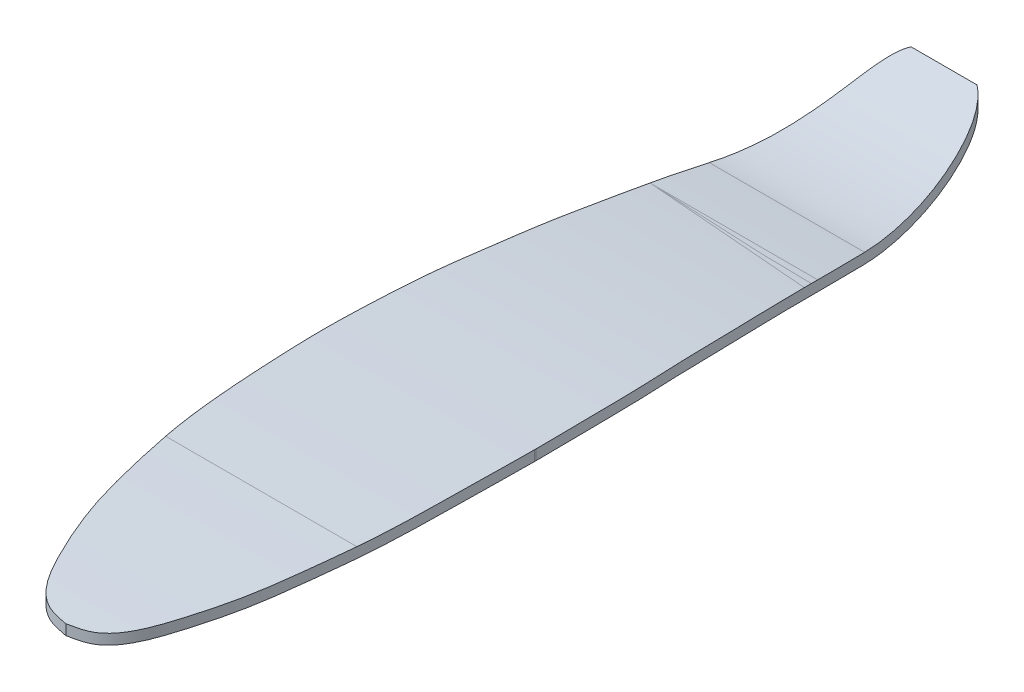
from build123d import *

# Parameters (mm, degrees)
BOSS_EXTRUDE1_DEPTH     = 102
CUT_EXTRUDE1_DEPTH      = 100
CUT_EXTRUDE1_DEPTH_BACK = 100
SKETCH9_OUTSIDE_W       = 383.336
SKETCH9_OUTSIDE_H       = 1040.511


with BuildPart() as part:
    # Sketch4 → Boss-Extrude1 (new, symmetric)
    with BuildSketch(Plane(origin=(0, 0, 0), x_dir=(0, 0, -1), z_dir=(1, 0, 0))):
        with BuildLine():
            Line((0, 0), (-1.175236097, 9.930700888))
            ThreePointArc((-1.175236097, 9.930700888), (350, 30.638141935), (701.175236097, 9.930700888))
            ThreePointArc((701.175236097, 9.930700888), (781.759467973, 16.244113872), (853.820514615, 52.862185471))
            Line((853.820514615, 52.862185471), (860, 45))
            ThreePointArc((860, 45), (784.466923743, 6.617604471), (700, 0))
            ThreePointArc((700, 0), (350, 20.638141935), (0, 0))
        make_face()
    extrude(amount=BOSS_EXTRUDE1_DEPTH, both=True)

    # Sketch9 outside → Cut-Extrude1 (cut, two sides: drawn at the far end of the back side and taken through both)
    with BuildSketch(Plane(origin=(0, 0, 0), x_dir=(1, 0, 0), z_dir=(0, 1, 0)).offset(-CUT_EXTRUDE1_DEPTH_BACK)):
        with Locations((0, 429.4125)):
            Rectangle(SKETCH9_OUTSIDE_W, SKETCH9_OUTSIDE_H)
        with BuildLine():
            add(Edge.make_bspline(
                [(0, 0), (6.949684174, 1.176515835), (35.07025548, 5.937062732), (58.348166284, 53.142776701), (77.037488771, 103.637606497), (87.180450732, 154.892232469), (95.846331303, 204.703932058), (99.26688254, 254.96702494), (101.060473074, 304.980056328), (102.487544, 355.002947506), (100.988766282, 405.008150114), (99.554196599, 455.074321396), (94.776844527, 504.983402802), (91.332569781, 555.061631258), (85.874335971, 604.978354091), (81.163424724, 655.09096952), (75.435021928, 705.002663637), (66.98194378, 755.696485581), (58.158927469, 804.91477527), (41.956976408, 858.72752335), (10.846160985, 859.671056216), (0, 860)],
                knots=[0, 0, 0, 0, 0.022198487, 0.089821941, 0.147043706, 0.202170459, 0.256694484, 0.310705733, 0.364588025, 0.41843803, 0.472288035, 0.526170327, 0.580181576, 0.634192825, 0.68830059, 0.742408354, 0.796633849, 0.851157875, 0.90606334, 0.96725087, 1, 1, 1, 1], degree=3))
            add(Edge.make_bspline(
                [(0, 0), (-6.949684174, 1.176515835), (-35.07025548, 5.937062732), (-58.348166284, 53.142776701), (-77.037488771, 103.637606497), (-87.180450732, 154.892232469), (-95.846331303, 204.703932058), (-99.26688254, 254.96702494), (-101.060473074, 304.980056328), (-102.487544, 355.002947506), (-100.988766282, 405.008150114), (-99.554196599, 455.074321396), (-94.776844527, 504.983402802), (-91.332569781, 555.061631258), (-85.874335971, 604.978354091), (-81.163424724, 655.09096952), (-75.435021928, 705.002663637), (-66.98194378, 755.696485581), (-58.158927469, 804.91477527), (-41.956976408, 858.72752335), (-10.846160985, 859.671056216), (0, 860)],
                knots=[0, 0, 0, 0, 0.022198487, 0.089821941, 0.147043706, 0.202170459, 0.256694484, 0.310705733, 0.364588025, 0.41843803, 0.472288035, 0.526170327, 0.580181576, 0.634192825, 0.68830059, 0.742408354, 0.796633849, 0.851157875, 0.90606334, 0.96725087, 1, 1, 1, 1], degree=3))
        make_face(mode=Mode.SUBTRACT)
    extrude(amount=CUT_EXTRUDE1_DEPTH + CUT_EXTRUDE1_DEPTH_BACK, mode=Mode.SUBTRACT)


solid = part.part
